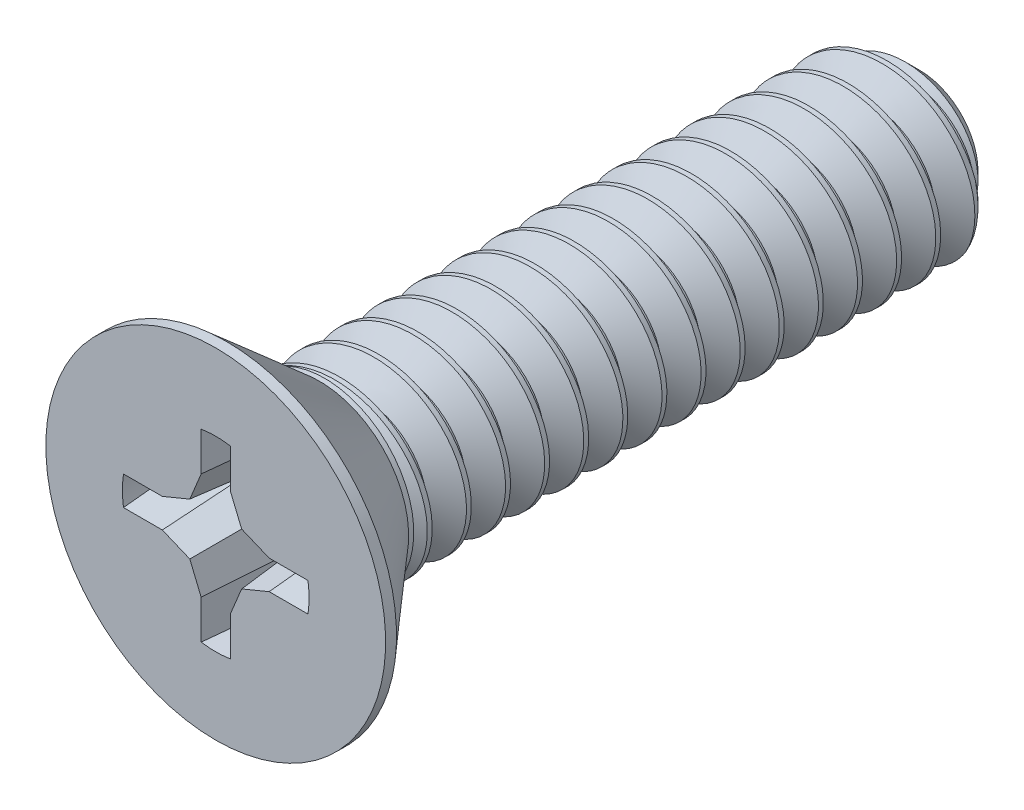
from build123d import *

# Parameters (mm, degrees)
CUT_EXTRUDE1_REACH = 22.129
CIRPATTERN1_COUNT  = 4
DRAFT2_ANGLE       = 5
CUT_SWEEP1_PITCH   = 1.058333333
CUT_SWEEP1_TO      = 16.1036


with BuildPart() as part:
    # Sketch3 → Revolve1 (revolve)
    with BuildSketch(Plane(origin=(0, 0, 0), x_dir=(0, 0, -1), z_dir=(1, 0, 0)), mode=Mode.PRIVATE) as revolve1_sk:
        Polygon((-2.9464, 4.5974), (-2.9464, 0), (-0.433535251, 0), (-0.433535251, 2.413), align=None)
    revolve(revolve1_sk.sketch.rotate(Axis((0, 0, 2.9464), (0, 0, -1)), 180), axis=Axis((0, 0, 2.9464), (0, 0, -1)))

    # Sketch5 → Revolve2 (revolve)
    with BuildSketch(Plane(origin=(0, 0, 0), x_dir=(0, 0, -1), z_dir=(1, 0, 0))):
        Polygon((16.1036, 0), (-0.433535251, 0), (-0.433535251, 2.413), (15.267516667, 2.413), (16.1036, 1.576916667), align=None)
    revolve(axis=Axis((0, 0, -16.1036), (0, 0, 1)))

    # Cut-Extrude1: up to this cone (the profile starts inside it)
    cut_extrude1_end = Plane(origin=(0, 0, 2.9464), z_dir=(0, 0, 1)).offset(-3.829108445) * Cone(1e-06, 25.893186318, 29.786702502, align=(Align.CENTER, Align.CENTER, Align.MIN), mode=Mode.PRIVATE)
    # Sketch4 → Cut-Extrude1 (cut, up to the surface)
    with BuildSketch(Plane.XY.offset(2.9464), mode=Mode.PRIVATE) as cut_extrude1_sk1:
        with BuildLine():
            Line((0, 0), (2.5273, 0))
            ThreePointArc((2.5273, 0), (2.519574842, 0.197453553), (2.496446595, 0.3937))
            Line((2.496446595, 0.3937), (1.445073297, 0.3937))
            Line((1.445073297, 0.3937), (0.701640109, 0.701640109))
            Line((0.701640109, 0.701640109), (0.3937, 1.445073297))
            Line((0.3937, 1.445073297), (0.3937, 2.496446595))
            ThreePointArc((0.3937, 2.496446595), (0.197453553, 2.519574842), (0, 2.5273))
            Line((0, 2.5273), (0, 0))
        make_face()
    cut_extrude1_tool1 = extrude(cut_extrude1_sk1.sketch, amount=-CUT_EXTRUDE1_REACH, mode=Mode.PRIVATE) & cut_extrude1_end
    cut_extrude1 = cut_extrude1_tool1.solids().sort_by_distance((0.035741, 1.26365, 2.9464))[0]
    add(cut_extrude1, mode=Mode.SUBTRACT)

    # CirPattern1: Cut-Extrude1 ×4 about axis
    cirpattern1_axis = Axis((0, 0, 0), (0, 0, 1))
    for i in range(1, CIRPATTERN1_COUNT):
        add(cut_extrude1.rotate(cirpattern1_axis, i * 360 / CIRPATTERN1_COUNT), mode=Mode.SUBTRACT)

    # Draft2
    draft2_faces = [part.faces().sort_by_distance(p)[0] for p in [
        (-1.902279256, 0.3937, 2.1497253),
        (-1.058321463, 0.553897855, 1.726533862),
        (-0.553897855, 1.058321463, 1.726533862),
        (-0.3937, 1.902279256, 2.1497253),
        (0.3937, 1.902279256, 2.1497253),
        (0.553897855, 1.058321463, 1.726533862),
        (1.058321463, 0.553897855, 1.726533862),
        (1.902279256, 0.3937, 2.1497253),
        (1.902279256, -0.3937, 2.1497253),
        (1.058321463, -0.553897855, 1.726533862),
        (0.553897855, -1.058321463, 1.726533862),
        (0.3937, -1.902279256, 2.1497253),
        (-0.3937, -1.902279256, 2.1497253),
        (-0.553897855, -1.058321463, 1.726533862),
        (-1.058321463, -0.553897855, 1.726533862),
        (-1.902279256, -0.3937, 2.1497253),
    ]]
    draft(draft2_faces, Plane(origin=(0, 0, 2.9464), x_dir=(0, 1, 0), z_dir=(0, 0, 1)), DRAFT2_ANGLE)

    # Sketch10 → Revolve3 (revolve)
    with BuildSketch(Plane(origin=(0, 0, 0), x_dir=(0, 0, -1), z_dir=(1, 0, 0))):
        Polygon((-2.9464, 4.5974), (-2.65176, 4.5974), (0, 2.2922602), (0, 2.036133556), align=None)
    revolve(axis=Axis((0, 0, 0), (0, 0, 1)))


with BuildPart() as body_2:
    # Split1: the piece on the far side of the plane
    add(part.part)
    split(bisect_by=Plane(origin=(0, 0, 0), x_dir=(0, -1, 0), z_dir=(0, 0, -1)), keep=Keep.BOTTOM)


with BuildPart() as part_1:
    add(part.part)

    # Split1
    split(bisect_by=Plane(origin=(0, 0, 0), x_dir=(0, -1, 0), z_dir=(0, 0, -1)), keep=Keep.TOP)

    # Cut-Sweep1: arcs per turn and ends read off the stored shape
    # Cut-Sweep1: the profile of Sketch7 screwed along a right-hand helix through 18 turns, 8 arcs to a turn; built about Z, then put on its axis
    cut_sweep1_z = Axis((0, 0, 0), (0, 0, 1))
    cut_sweep1_corners = [(1.725592336, 0, -0.529166667), (1.725592336, 0, -0.396875), (2.470283972, 0, 0.033072917), (2.470283972, 0, -0.959114583)]
    with BuildLine(mode=Mode.PRIVATE) as cut_sweep1_profile:
        Line(cut_sweep1_corners[0], cut_sweep1_corners[1])
        Line(cut_sweep1_corners[1], cut_sweep1_corners[2])
        Line(cut_sweep1_corners[2], cut_sweep1_corners[3])
        Line(cut_sweep1_corners[3], cut_sweep1_corners[0])
    cut_sweep1_cap = Face(cut_sweep1_profile.wire())
    cut_sweep1_turn_angles = [0, 22.5, 45, 67.5, 90, 112.5, 135, 157.5, 180, 202.5, 225, 247.5, 270, 292.5, 315, 337.5, 360]
    cut_sweep1_turn_weights = [1, 0.9238795325112867, 1, 0.9238795325112867, 1, 0.9238795325112867, 1, 0.9238795325112867, 1, 0.9238795325112867, 1, 0.9238795325112867, 1, 0.9238795325112867, 1, 0.9238795325112867, 1]
    cut_sweep1_turn_rails = [Edge.make_bspline([Vector(p[0], p[1], 0).rotate(cut_sweep1_z, cut_sweep1_turn_angles[k]) / cut_sweep1_turn_weights[k] + Vector(0, 0, p[2] + CUT_SWEEP1_PITCH * cut_sweep1_turn_angles[k] / 360) for k in range(17)], [0, 0, 0, 1, 1, 2, 2, 3, 3, 4, 4, 5, 5, 6, 6, 7, 7, 8, 8, 8], 2, cut_sweep1_turn_weights) for p in cut_sweep1_corners]
    cut_sweep1_turn_sides = [Face.make_surface_from_curves(cut_sweep1_turn_rails[p[0]], cut_sweep1_turn_rails[p[1]]) for p in [(0, 1), (1, 2), (2, 3), (3, 0)]]
    cut_sweep1 = Plane(origin=(0, 0, -16.1036), x_dir=(0, 1, 0), z_dir=(0, 0, 1)) * split(Solid(Shell([*[p.moved(Location((0, 0, CUT_SWEEP1_PITCH * i))) for i in range(18) for p in cut_sweep1_turn_sides], cut_sweep1_cap, cut_sweep1_cap.rotate(cut_sweep1_z, 6480).moved(Location((0, 0, CUT_SWEEP1_PITCH * 6480 / 360)))])), bisect_by=Plane.XY.offset(CUT_SWEEP1_TO), keep=Keep.BOTTOM, mode=Mode.PRIVATE)
    add(cut_sweep1, mode=Mode.SUBTRACT)

    add(body_2.part)  # Boss-Extrude2 merges body 2
    # Boss-Extrude2: read off the stored shape, not the designer's step
    # Boss-Extrude2 outline → Boss-Extrude2 (revolve)
    with BuildSketch(Plane.XZ):
        Polygon((0, 0), (0, -0.882709445), (0.767327614, 0), align=None)
        Polygon((2.413, 0), (1.725586612, 0), (1.725586612, -0.40210293), align=None)
    revolve(axis=Axis((0, 0, 0), (0, 0, 1)))


solid = part_1.part
